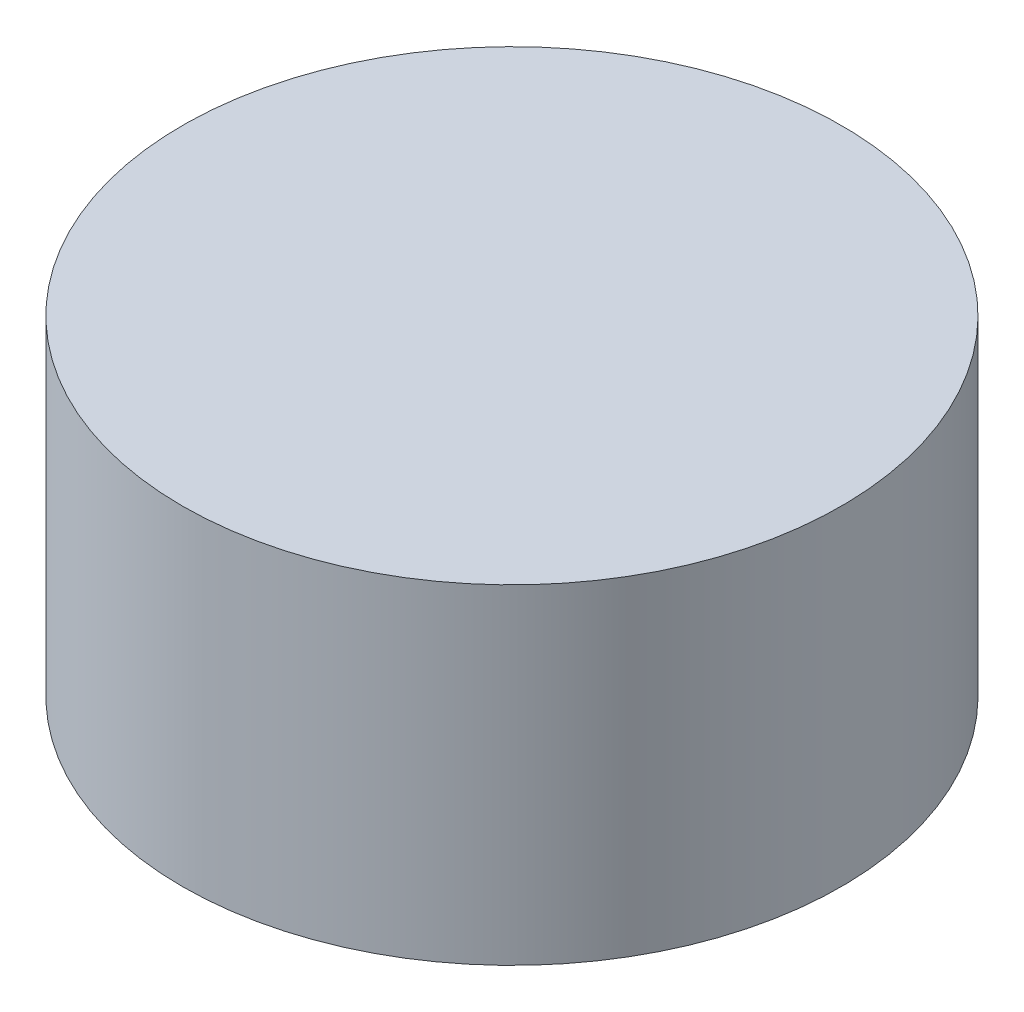
from build123d import *

# Parameters (mm, degrees)
SKETCH1_R           = 4
BOSS_EXTRUDE1_DEPTH = 2


with BuildPart() as part:
    # Sketch1 → Boss-Extrude1 (new, symmetric)
    with BuildSketch(Plane(origin=(0, 0, 0), x_dir=(1, 0, 0), z_dir=(0, 1, 0))):
        Circle(SKETCH1_R)
    extrude(amount=BOSS_EXTRUDE1_DEPTH, both=True)


solid = part.part
